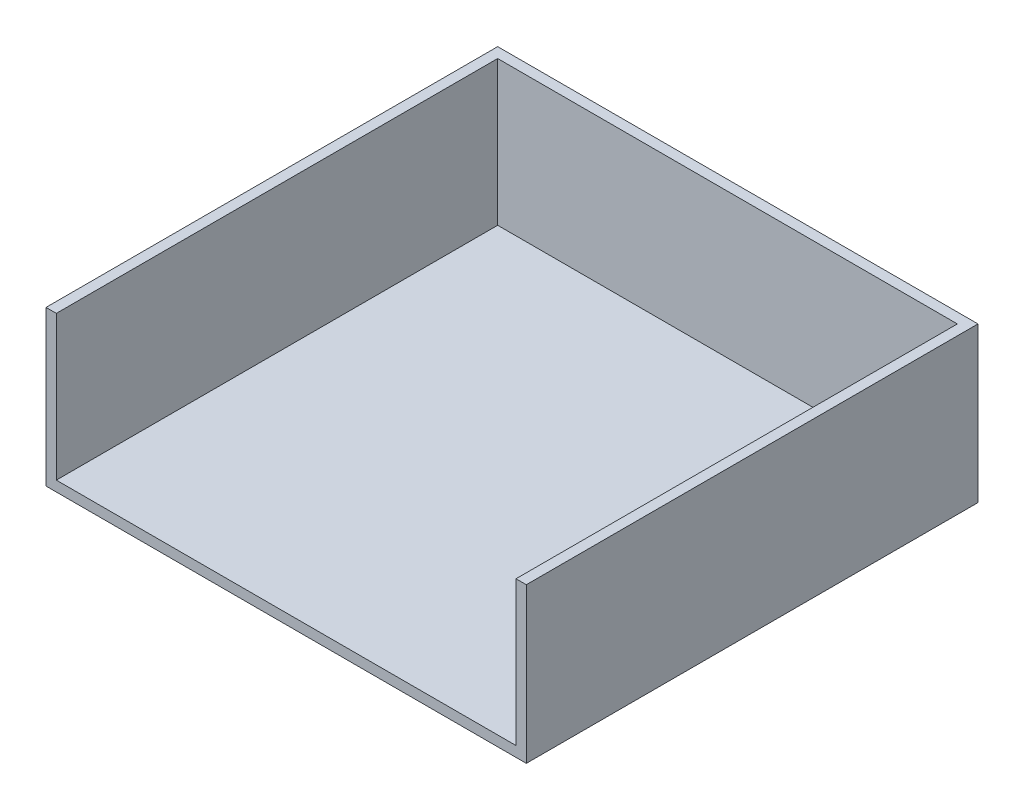
from build123d import *

# Parameters (mm, degrees)
SKETCH1_W           = 89.12
SKETCH1_H           = 85.57
BOSS_EXTRUDE1_DEPTH = 2
SKETCH3_W           = 2
SKETCH3_H           = 30
BOSS_EXTRUDE2_DEPTH = 85.57
SKETCH4_W           = 2
SKETCH4_H           = 30
BOSS_EXTRUDE3_DEPTH = 85.57
SKETCH5_W           = 93.12
SKETCH5_H           = 2
BOSS_EXTRUDE4_DEPTH = 30


with BuildPart() as part:
    # Sketch1 → Boss-Extrude1 (new body)
    with BuildSketch(Plane(origin=(0, 0, 0), x_dir=(1, 0, 0), z_dir=(0, 1, 0))):
        with Locations((44.56, 42.785)):
            Rectangle(SKETCH1_W, SKETCH1_H)
    extrude(amount=BOSS_EXTRUDE1_DEPTH)

    # Sketch3 → Boss-Extrude2 (add)
    with BuildSketch(Plane.XY):
        with Locations((-1, 15)):
            Rectangle(SKETCH3_W, SKETCH3_H)
    extrude(amount=-BOSS_EXTRUDE2_DEPTH)

    # Sketch4 → Boss-Extrude3 (add)
    with BuildSketch(Plane.XY):
        with Locations((90.12, 15)):
            Rectangle(SKETCH4_W, SKETCH4_H)
    extrude(amount=-BOSS_EXTRUDE3_DEPTH)

    # Sketch5 → Boss-Extrude4 (add)
    with BuildSketch(Plane(origin=(0, 0, 0), x_dir=(1, 0, 0), z_dir=(0, 1, 0))):
        with Locations((44.56, 86.57)):
            Rectangle(SKETCH5_W, SKETCH5_H)
    extrude(amount=BOSS_EXTRUDE4_DEPTH)


solid = part.part
